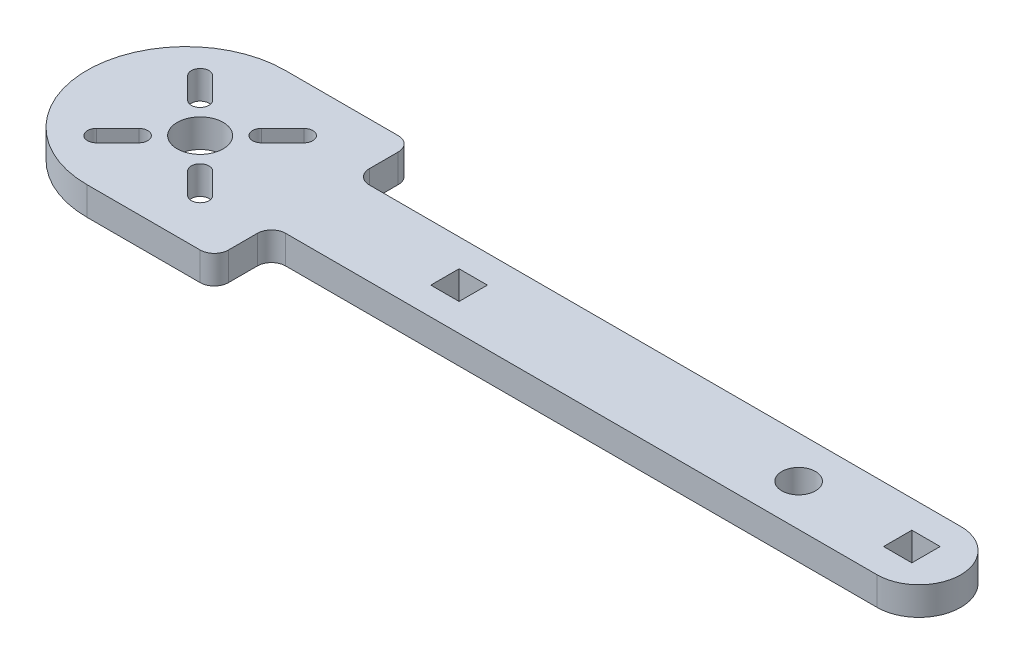
from build123d import *

# Parameters (mm, degrees)
SKETCH1_R           = 3.25
SKETCH1_R_2         = 2.38125
SKETCH1_W           = 4
SKETCH1_H           = 4
BOSS_EXTRUDE1_DEPTH = 4


with BuildPart() as part:
    # Sketch1 → Boss-Extrude1 (new body)
    with BuildSketch(Plane(origin=(0, 0, 0), x_dir=(1, 0, 0), z_dir=(0, 1, 0))):
        with BuildLine():
            Line((-50.8, 14), (-36.8, 14))
            ThreePointArc((-36.8, 14), (-35.385786438, 13.414213562), (-34.8, 12))
            Line((-34.8, 12), (-34.8, 7.914556152))
            ThreePointArc((-34.8, 7.914556152), (-34.214213562, 6.500342589), (-32.8, 5.914556152))
            Line((-32.8, 5.914556152), (50.8, 5.914556152))
            ThreePointArc((50.8, 5.914556152), (56.714556152, 0), (50.8, -5.914556152))
            Line((50.8, -5.914556152), (-32.8, -5.914556152))
            ThreePointArc((-32.8, -5.914556152), (-34.214213562, -6.500342589), (-34.8, -7.914556152))
            Line((-34.8, -7.914556152), (-34.8, -12))
            ThreePointArc((-34.8, -12), (-35.385786438, -13.414213562), (-36.8, -14))
            Line((-36.8, -14), (-50.8, -14))
            Line((-50.8, -14), (-52.8, -14))
            ThreePointArc((-52.8, -14), (-66.8, 0), (-52.8, 14))
            Line((-52.8, 14), (-50.8, 14))
        make_face()
        with Locations((-50.8, 0)):
            Circle(SKETCH1_R, mode=Mode.SUBTRACT)
        with Locations((33.8, 0)):
            Circle(SKETCH1_R_2, mode=Mode.SUBTRACT)
        with BuildLine():
            Line((-57.252349378, 8.220116331), (-54.247145558, 5.214912511))
            ThreePointArc((-54.247145558, 5.214912511), (-54.247145558, 3.447145558), (-56.014912511, 3.447145558))
            Line((-56.014912511, 3.447145558), (-59.020116331, 6.452349378))
            ThreePointArc((-59.020116331, 6.452349378), (-59.020116331, 8.220116331), (-57.252349378, 8.220116331))
        make_face(mode=Mode.SUBTRACT)
        with BuildLine():
            Line((-42.579883669, 6.452349378), (-45.585087489, 3.447145558))
            ThreePointArc((-45.585087489, 3.447145558), (-47.352854442, 3.447145558), (-47.352854442, 5.214912511))
            Line((-47.352854442, 5.214912511), (-44.347650622, 8.220116331))
            ThreePointArc((-44.347650622, 8.220116331), (-42.579883669, 8.220116331), (-42.579883669, 6.452349378))
        make_face(mode=Mode.SUBTRACT)
        with BuildLine():
            Line((-44.347650622, -8.220116331), (-47.352854442, -5.214912511))
            ThreePointArc((-47.352854442, -5.214912511), (-47.352854442, -3.447145558), (-45.585087489, -3.447145558))
            Line((-45.585087489, -3.447145558), (-42.579883669, -6.452349378))
            ThreePointArc((-42.579883669, -6.452349378), (-42.579883669, -8.220116331), (-44.347650622, -8.220116331))
        make_face(mode=Mode.SUBTRACT)
        with BuildLine():
            Line((-59.020116331, -6.452349378), (-56.014912511, -3.447145558))
            ThreePointArc((-56.014912511, -3.447145558), (-54.247145558, -3.447145558), (-54.247145558, -5.214912511))
            Line((-54.247145558, -5.214912511), (-57.252349378, -8.220116331))
            ThreePointArc((-57.252349378, -8.220116331), (-59.020116331, -8.220116331), (-59.020116331, -6.452349378))
        make_face(mode=Mode.SUBTRACT)
        with Locations((49.8, 0)):
            Rectangle(SKETCH1_W, SKETCH1_H, mode=Mode.SUBTRACT)
        with Locations((-14.2, 0)):
            Rectangle(SKETCH1_W, SKETCH1_H, mode=Mode.SUBTRACT)
    extrude(amount=BOSS_EXTRUDE1_DEPTH)


solid = part.part
